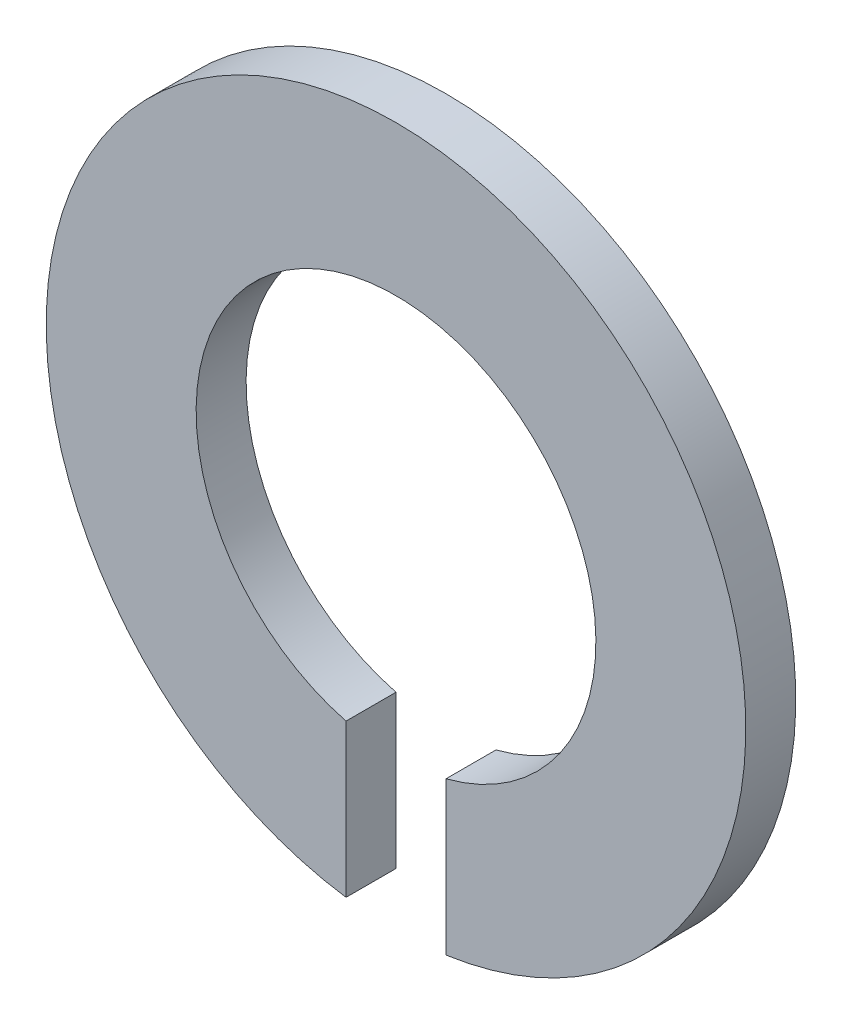
from build123d import *

# Parameters (mm, degrees)
BOSS_EXTRU_1_DEPTH = 0.5


with BuildPart() as part:
    # Esquisse2 → Boss.-Extru.1 (new body)
    with BuildSketch(Plane.XY):
        with BuildLine():
            Line((0.5, -1.936491673), (0.5, -3.464101615))
            ThreePointArc((0.5, -3.464101615), (0, 3.5), (-0.5, -3.464101615))
            Line((-0.5, -3.464101615), (-0.5, -1.936491673))
            ThreePointArc((-0.5, -1.936491673), (0, 2), (0.5, -1.936491673))
        make_face()
    extrude(amount=BOSS_EXTRU_1_DEPTH)


solid = part.part
